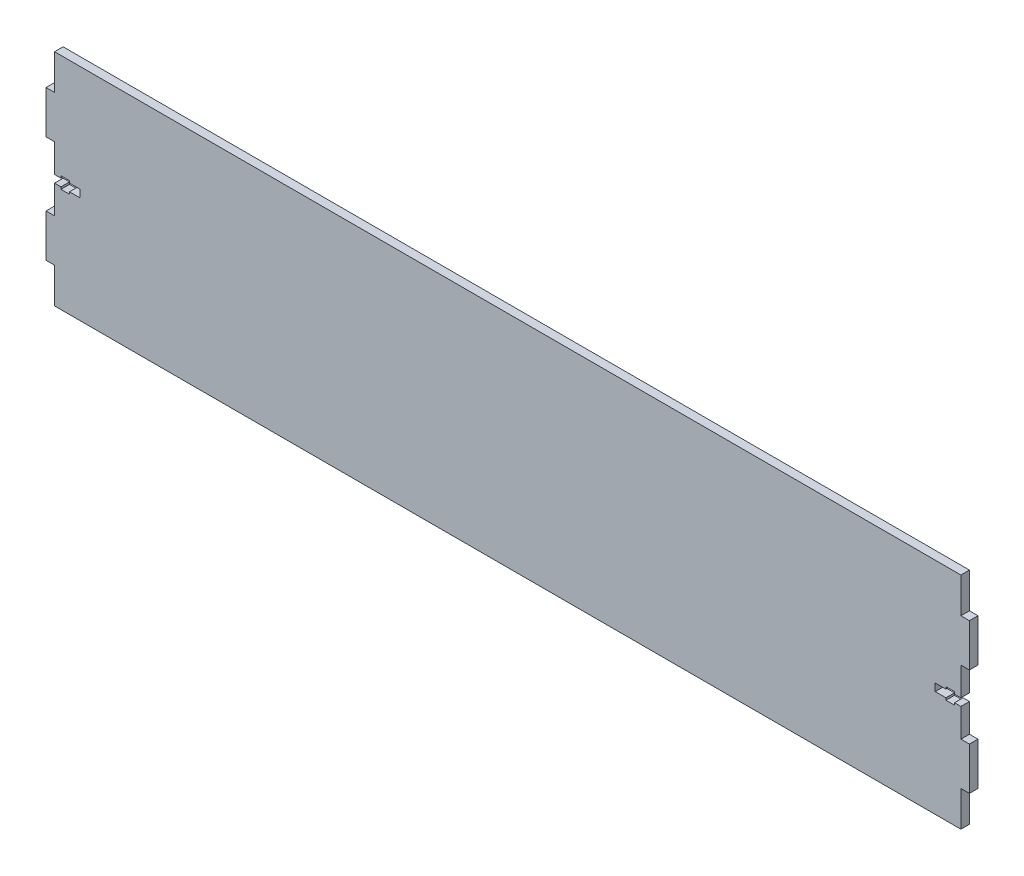
from build123d import *

# Parameters (mm, degrees)
SKETCH1_W          = 424
SKETCH1_H          = 103
BASE_FLANGE1_DEPTH = 4
SKETCH4_W          = 4
SKETCH4_H          = 20
TAB1_DEPTH         = 4
CUT_EXTRUDE1_DEPTH = 223.090634652


# Sheet-metal steps are written as plain solids
with BuildPart() as part:
    # Sketch1 → Base-Flange1 (new body)
    with BuildSketch(Plane.XY):
        Rectangle(SKETCH1_W, SKETCH1_H)
    extrude(amount=-BASE_FLANGE1_DEPTH)

    # Sketch4 → Tab1 (add)
    with BuildSketch(Plane.XY):
        with Locations((-214, 25)):
            Rectangle(SKETCH4_W, SKETCH4_H)
        with Locations((-214, -25)):
            Rectangle(SKETCH4_W, SKETCH4_H)
        with Locations((214, 25)):
            Rectangle(SKETCH4_W, SKETCH4_H)
        with Locations((214, -25)):
            Rectangle(SKETCH4_W, SKETCH4_H)
    extrude(amount=-TAB1_DEPTH)

    # Sketch5 → Cut-Extrude1 (cut, through all)
    with BuildSketch(Plane.XY):
        Polygon((-212, 1.75), (-209, 1.75), (-209, 2.75), (-205, 2.75), (-205, 1.75), (-200, 1.75), (-200, -1.75), (-205, -1.75), (-205, -2.75), (-209, -2.75), (-209, -1.75), (-212, -1.75), align=None)
        Polygon((212, -1.75), (212, 1.75), (209, 1.75), (209, 2.75), (205, 2.75), (205, 1.75), (200, 1.75), (200, -1.75), (205, -1.75), (205, -2.75), (209, -2.75), (209, -1.75), align=None)
    extrude(amount=-CUT_EXTRUDE1_DEPTH, mode=Mode.SUBTRACT)


solid = part.part
